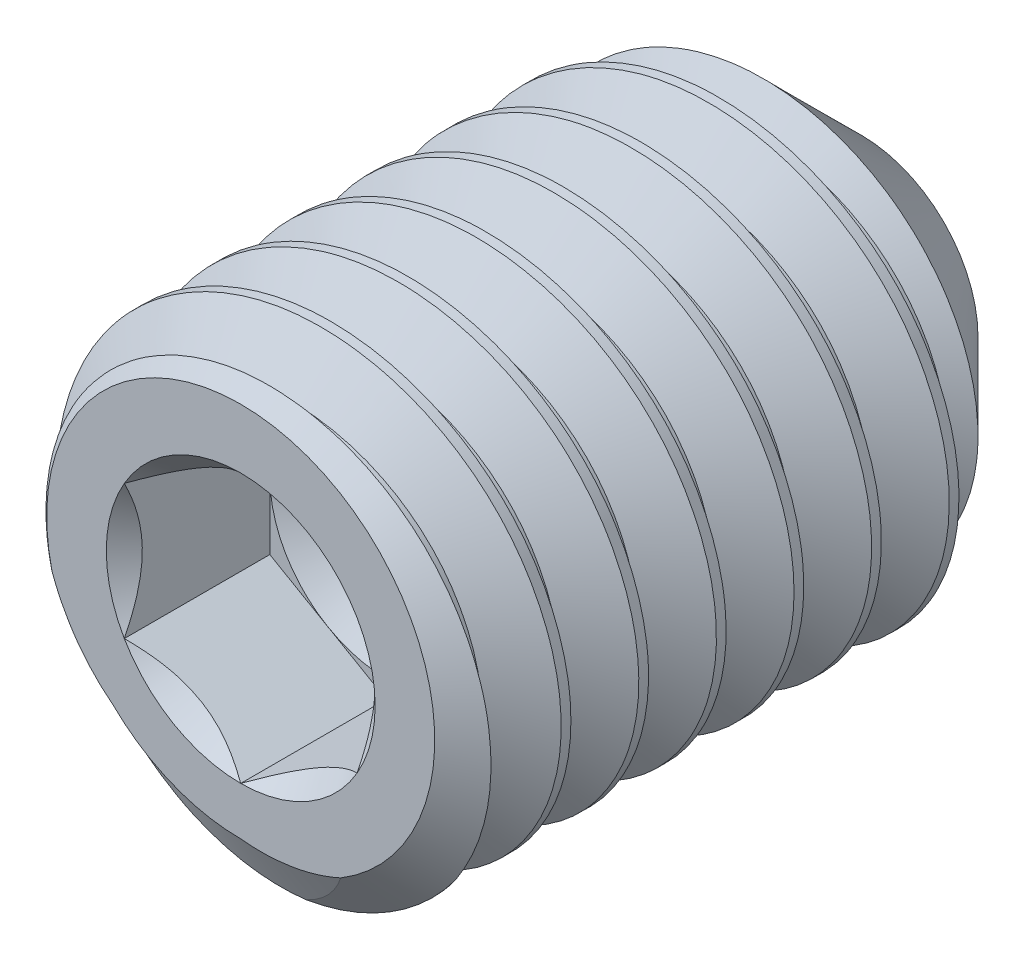
from build123d import *

# Parameters (mm, degrees)
CUT_EXTRUDE1_DEPTH = 0.9375
CUT_SWEEP1_PITCH   = 0.5


with BuildPart() as part:
    # Sketch11 → Revolve1 (revolve)
    with BuildSketch(Plane(origin=(0, 0, 0), x_dir=(0, 0, -1), z_dir=(1, 0, 0)), mode=Mode.PRIVATE) as revolve1_sk:
        Polygon((-2, 0), (-2, 1.25), (-1.824948115, 1.5), (1.25, 1.5), (2, 0.75), (1.549354536, 0), align=None)
    revolve(revolve1_sk.sketch.rotate(Axis((0, 0, -1.549354536), (0, 0, -1)), 180), axis=Axis((0, 0, -1.549354536), (0, 0, -1)))

    # Sketch2 → Cut-Extrude1 (cut)
    with BuildSketch(Plane.XY.offset(2)):
        Polygon((0, 0.866025404), (-0.75, 0.433012702), (-0.75, -0.433012702), (0, -0.866025404), (0.75, -0.433012702), (0.75, 0.433012702), align=None)
    extrude(amount=-CUT_EXTRUDE1_DEPTH, mode=Mode.SUBTRACT)

    # Cut-Extrude2 cone 1 section (through the dimple's axis) → Cut-Extrude2 (revolve, cut)
    with BuildSketch(Plane(origin=(0, 0, 2), x_dir=(0, -1, 0), z_dir=(1, 0, 0))):
        Polygon((0, 0), (0.866025404, 0), (0, 0.866025404), align=None)
    revolve(axis=Axis((0, 0, 2), (0, 0, -1)), mode=Mode.SUBTRACT)

    # Cut-Extrude3 cone 1 section (through the dimple's axis) → Cut-Extrude3 (revolve, cut)
    with BuildSketch(Plane(origin=(0, 0, 1.0625), x_dir=(0, -1, 0), z_dir=(1, 0, 0))):
        Polygon((0, 0), (0.75, 0), (0, 0.433012702), align=None)
    revolve(axis=Axis((0, 0, 1.0625), (0, 0, -1)), mode=Mode.SUBTRACT)

    # Cut-Sweep1: the profile of Sketch6 screwed along a right-hand helix of 8.8 turns, 6 arcs to a turn; built about Z, then put on its axis
    cut_sweep1_z = Axis((0, 0, 0), (0, 0, 1))
    cut_sweep1_corners = [(1.527063294, 0, 0.015625), (1.527063294, 0, -0.453125), (1.175240474, 0, -0.25), (1.175240474, 0, -0.1875)]
    with BuildLine(mode=Mode.PRIVATE) as cut_sweep1_profile:
        Line(cut_sweep1_corners[0], cut_sweep1_corners[1])
        Line(cut_sweep1_corners[1], cut_sweep1_corners[2])
        Line(cut_sweep1_corners[2], cut_sweep1_corners[3])
        Line(cut_sweep1_corners[3], cut_sweep1_corners[0])
    cut_sweep1_cap = Face(cut_sweep1_profile.wire())
    cut_sweep1_turn_angles = [0, 30, 60, 90, 120, 150, 180, 210, 240, 270, 300, 330, 360]
    cut_sweep1_turn_weights = [1, 0.8660254037844387, 1, 0.8660254037844387, 1, 0.8660254037844387, 1, 0.8660254037844387, 1, 0.8660254037844387, 1, 0.8660254037844387, 1]
    cut_sweep1_turn_rails = [Edge.make_bspline([Vector(p[0], p[1], 0).rotate(cut_sweep1_z, cut_sweep1_turn_angles[k]) / cut_sweep1_turn_weights[k] + Vector(0, 0, p[2] + CUT_SWEEP1_PITCH * cut_sweep1_turn_angles[k] / 360) for k in range(13)], [0, 0, 0, 1, 1, 2, 2, 3, 3, 4, 4, 5, 5, 6, 6, 6], 2, cut_sweep1_turn_weights) for p in cut_sweep1_corners]
    cut_sweep1_turn_sides = [Face.make_surface_from_curves(cut_sweep1_turn_rails[p[0]], cut_sweep1_turn_rails[p[1]]) for p in [(0, 1), (1, 2), (2, 3), (3, 0)]]
    cut_sweep1_last_angles = [2880, 2910, 2940, 2970, 3000, 3030, 3060, 3090, 3120, 3144, 3168]
    cut_sweep1_last_weights = [1, 0.8660254037844387, 1, 0.8660254037844387, 1, 0.8660254037844387, 1, 0.8660254037844387, 1, 0.9135454576425122, 1]
    cut_sweep1_last_rails = [Edge.make_bspline([Vector(p[0], p[1], 0).rotate(cut_sweep1_z, cut_sweep1_last_angles[k]) / cut_sweep1_last_weights[k] + Vector(0, 0, p[2] + CUT_SWEEP1_PITCH * cut_sweep1_last_angles[k] / 360) for k in range(11)], [0, 0, 0, 1, 1, 2, 2, 3, 3, 4, 4, 5, 5, 5], 2, cut_sweep1_last_weights) for p in cut_sweep1_corners]
    cut_sweep1_last_sides = [Face.make_surface_from_curves(cut_sweep1_last_rails[p[0]], cut_sweep1_last_rails[p[1]]) for p in [(0, 1), (1, 2), (2, 3), (3, 0)]]
    cut_sweep1 = Plane(origin=(0, 0, -2), x_dir=(0, 1, 0), z_dir=(0, 0, 1)) * Solid(Shell([*[p.moved(Location((0, 0, CUT_SWEEP1_PITCH * i))) for i in range(8) for p in cut_sweep1_turn_sides], *cut_sweep1_last_sides, cut_sweep1_cap, cut_sweep1_cap.rotate(cut_sweep1_z, 3168).moved(Location((0, 0, CUT_SWEEP1_PITCH * 3168 / 360)))]))
    add(cut_sweep1, mode=Mode.SUBTRACT)


solid = part.part
